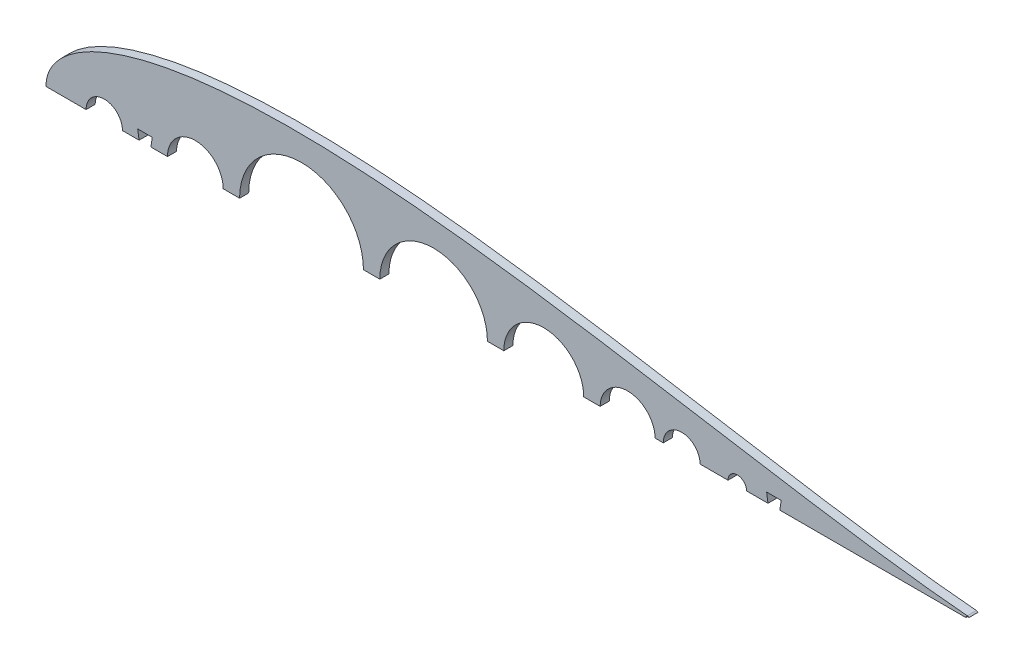
from build123d import *

# Parameters (mm, degrees)
BOSS_EXTRUDE1_DEPTH     = 6.35
CUT_EXTRUDE1_DEPTH      = 647.819942004
CUT_EXTRUDE1_DEPTH_BACK = 647.819942004
SKETCH4_W               = 6.35
SKETCH4_H               = 6.35
CUT_EXTRUDE2_DEPTH      = 6.35
CUT_EXTRUDE3_START      = -6.35
CUT_EXTRUDE3_DEPTH      = 6.35


# Read off the part's stored shape, not the designer's step: Cut-Extrude3
with BuildPart() as part:
    # Sketch2 → Boss-Extrude1 (new body)
    with BuildSketch(Plane.XY):
        with BuildLine():
            ThreePointArc((84.709, 0), (104.14, 19.431), (123.571, 0))
            Line((123.571, 0), (460.660965279, 0))
            Line((460.660965279, 0), (473.360965279, 0))
            Line((473.360965279, 0), (643.966787522, 0))
            ThreePointArc((643.966787522, 0), (643.547407924, 1.075012082), (642.510849283, 1.582039112))
            add(Edge.make_bspline(
                [(642.510849283, 1.582039112), (641.993392355, 1.625070631), (638.093728429, 1.953546407), (630.413817462, 2.663385493), (619.014124193, 3.849253664), (606.374988512, 5.304428983), (592.543922516, 7.037634907), (577.585454095, 9.050636147), (561.564270734, 11.338919625), (544.549749946, 13.890665375), (526.614143658, 16.687720753), (507.832591566, 19.705111663), (488.282710288, 22.911672601), (468.044367735, 26.27043606), (447.199424328, 29.739007432), (425.831595832, 33.270324121), (404.02631566, 36.813220545), (381.870662856, 40.313266856), (359.453314895, 43.713502532), (336.86454415, 46.955447457), (314.196207315, 49.979843895), (291.541767704, 52.727712704), (268.996310773, 55.141201012), (246.65655865, 57.164603829), (224.620860897, 58.745176641), (202.989192599, 59.8341217), (181.863132616, 60.387506142), (161.345829027, 60.366961324), (141.542033828, 59.739895824), (122.558104573, 58.481758104), (104.502313427, 56.574303932), (87.485018636, 54.008935199), (71.619696083, 50.784752003), (57.023709725, 46.912543066), (43.82045433, 42.41500246), (32.141645239, 37.332204029), (22.129107375, 31.731455339), (13.932423524, 25.726412106), (7.689616489, 19.513207632), (3.463136343, 13.420354421), (1.106333228, 7.923389435), (0.154611582, 3.513796615), (0, 1.007496172), (0, 0)],
                knots=[0.020157042, 0.020157042, 0.020157042, 0.020157042, 0.021270888, 0.028552555, 0.036780684, 0.045920102, 0.055931764, 0.066772884, 0.07839713, 0.090754827, 0.103793165, 0.117456432, 0.131686226, 0.146421738, 0.161599998, 0.177156133, 0.193023668, 0.209134786, 0.225420633, 0.241811602, 0.258237647, 0.274628557, 0.290914287, 0.307025229, 0.322892517, 0.338448342, 0.353626207, 0.368361232, 0.382590428, 0.396252961, 0.409290412, 0.42164701, 0.433269881, 0.444109249, 0.45411864, 0.463255055, 0.471479114, 0.478755289, 0.485052318, 0.490344026, 0.494609833, 0.497833231, 0.5, 0.5, 0.5, 0.5], degree=3))
            Line((0, 0), (27.94, 0))
            ThreePointArc((27.94, 0), (40.64, 12.7), (53.34, 0))
            Line((53.34, 0), (84.709, 0))
        make_face()
    extrude(amount=BOSS_EXTRUDE1_DEPTH)

    # Sketch3 → Cut-Extrude1 (cut, two sides: drawn at the far end of the back side and taken through both)
    with BuildSketch(Plane.XY.offset(6.35).offset(-CUT_EXTRUDE1_DEPTH_BACK)):
        with BuildLine():
            Line((135.001, 0), (221.368346157, 0))
            ThreePointArc((221.368346157, 0), (178.184673078, 43.183673078), (135.001, 0))
        make_face()
        with BuildLine():
            ThreePointArc((135.001, 0), (178.184673078, -43.183673078), (221.368346157, 0))
            Line((221.368346157, 0), (135.001, 0))
        make_face()
        with BuildLine():
            ThreePointArc((307.839599131, 0), (270.318972644, 37.520626487), (232.798346157, 0))
            Line((232.798346157, 0), (307.839599131, 0))
        make_face()
        with BuildLine():
            Line((307.839599131, 0), (232.798346157, 0))
            ThreePointArc((232.798346157, 0), (270.318972644, -37.520626487), (307.839599131, 0))
        make_face()
        with BuildLine():
            ThreePointArc((374.99479385, 0), (347.13219649, 27.862597359), (319.269599131, 0))
            Line((319.269599131, 0), (374.99479385, 0))
        make_face()
        with BuildLine():
            Line((374.99479385, 0), (319.269599131, 0))
            ThreePointArc((319.269599131, 0), (347.13219649, -27.862597359), (374.99479385, 0))
        make_face()
        with BuildLine():
            ThreePointArc((424.777212339, 0), (405.60179385, 18.930718125), (386.426375361, 0))
            Line((386.426375361, 0), (424.777212339, 0))
        make_face()
        with BuildLine():
            Line((424.777212339, 0), (386.426375361, 0))
            ThreePointArc((386.426375361, 0), (405.478650373, -19.422886493), (424.77879385, -0.246281875))
            ThreePointArc((424.77879385, -0.246281875), (424.778398468, -0.123138399), (424.777212339, 0))
        make_face()
        with BuildLine():
            ThreePointArc((456.128866123, 0), (443.301866123, 12.827), (430.474866123, 0))
            Line((430.474866123, 0), (456.128866123, 0))
        make_face()
        with BuildLine():
            Line((456.128866123, 0), (430.474866123, 0))
            ThreePointArc((430.474866123, 0), (443.301866123, -12.827), (456.128866123, 0))
        make_face()
        with BuildLine():
            ThreePointArc((488.559534569, 0), (482.082534569, 6.477), (475.605534569, 0))
            Line((475.605534569, 0), (488.559534569, 0))
        make_face()
        with BuildLine():
            Line((488.559534569, 0), (475.605534569, 0))
            ThreePointArc((475.605534569, 0), (482.082534569, -6.477), (488.559534569, 0))
        make_face()
    extrude(amount=CUT_EXTRUDE1_DEPTH + CUT_EXTRUDE1_DEPTH_BACK, mode=Mode.SUBTRACT)

    # Sketch4 → Cut-Extrude2 (cut)
    with BuildSketch(Plane.XY.offset(6.35)):
        Polygon((504.434534569, 0), (504.434534569, 6.35), (502.529534569, 6.35), (503.482034569, 0), align=None)
        with Locations((507.609534569, 3.175)):
            Rectangle(SKETCH4_W, SKETCH4_H)
        Polygon((512.689534569, 6.35), (510.784534569, 6.35), (510.784534569, 0), (511.737034569, 0), align=None)
        Polygon((63.9445, 6.35), (64.897, 0), (65.8495, 0), (65.8495, 6.35), align=None)
        with Locations((69.0245, 3.175)):
            Rectangle(SKETCH4_W, SKETCH4_H)
        Polygon((72.1995, 6.35), (72.1995, 0), (73.152, 0), (74.1045, 6.35), align=None)
    extrude(amount=-CUT_EXTRUDE2_DEPTH, mode=Mode.SUBTRACT)

    # Cut-Extrude3 outline → Cut-Extrude3 (cut)
    with BuildSketch(Plane.XY.offset(6.35).offset(CUT_EXTRUDE3_START)):
        with BuildLine():
            ThreePointArc((643.966787522, 0), (643.872033495, 0.540245973), (643.599082689, 1.016))
            ThreePointArc((643.599082689, 1.016), (642.269121423, 1.135922533), (641.567082689, 0))
            Line((641.567082689, 0), (643.966787522, 0))
        make_face()
    extrude(amount=CUT_EXTRUDE3_DEPTH, mode=Mode.SUBTRACT)


solid = part.part
